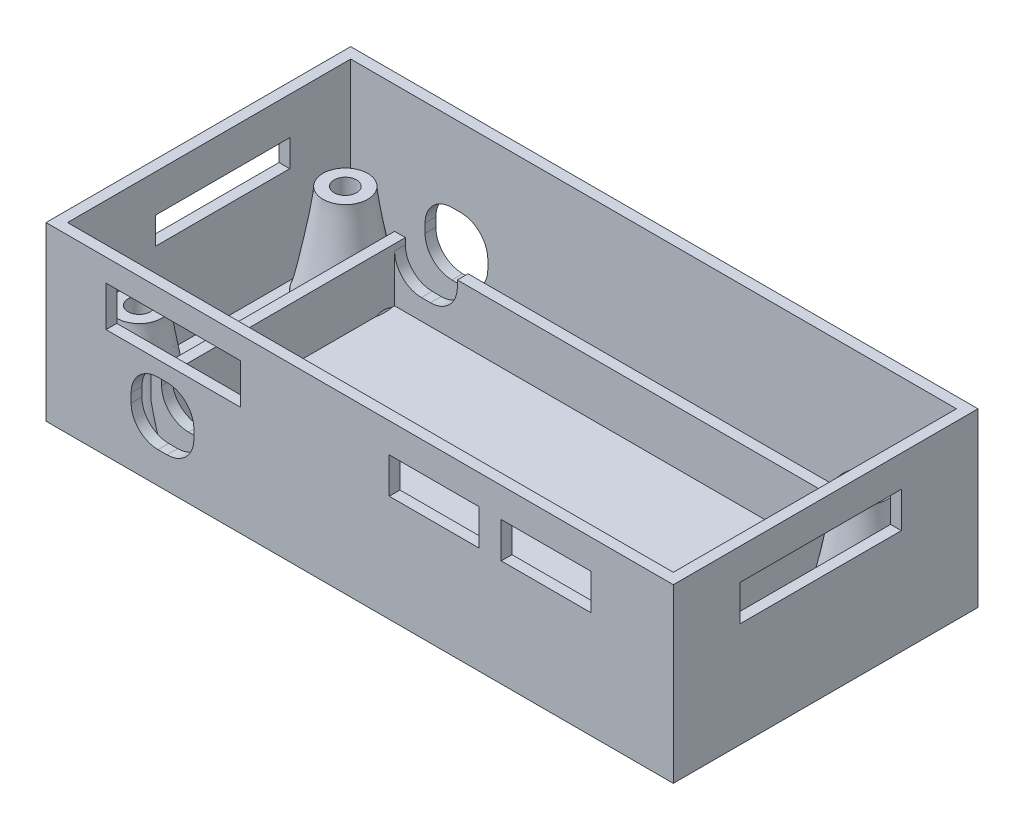
from build123d import *

# Parameters (mm, degrees)
SKETCH1_W           = 70
SKETCH1_H           = 34
BOSS_EXTRUDE1_DEPTH = 1.2
SKETCH2_W           = 70
SKETCH2_H           = 34
SKETCH2_W_2         = 67.6
SKETCH2_H_2         = 31.6
BOSS_EXTRUDE2_DEPTH = 18
SKETCH3_R           = 2.5
BOSS_EXTRUDE3_DEPTH = 10
SKETCH4_R           = 1.25
CUT_EXTRUDE1_DEPTH  = 79.622134288
SKETCH5_W           = 15
SKETCH5_H           = 3
CUT_EXTRUDE2_DEPTH  = 2
SKETCH7_W           = 10
SKETCH7_H           = 4
CUT_EXTRUDE3_DEPTH  = 2
SKETCH8_W           = 15
SKETCH8_H           = 4.5
CUT_EXTRUDE4_DEPTH  = 2
SKETCH9_W           = 18
SKETCH9_H           = 4
CUT_EXTRUDE5_DEPTH  = 2
FILLET1_SIZE        = 1.9
FILLET1_SIZE_2      = 10
SKETCH10_W          = 51.9
SKETCH10_H          = 27.2
SKETCH10_W_2        = 49.5
SKETCH10_H_2        = 24.8
BOSS_EXTRUDE4_DEPTH = 6
SKETCH12_W          = 7
SKETCH12_H          = 7
CUT_EXTRUDE7_DEPTH  = 81.153852084
FILLET2_R           = 3


with BuildPart() as part:
    # Sketch1 → Boss-Extrude1 (new body)
    with BuildSketch(Plane(origin=(0, 0, 0), x_dir=(1, 0, 0), z_dir=(0, 1, 0))):
        with Locations((35, -17)):
            Rectangle(SKETCH1_W, SKETCH1_H)
    extrude(amount=BOSS_EXTRUDE1_DEPTH)

    # Sketch2 → Boss-Extrude2 (add)
    with BuildSketch(Plane(origin=(0, 1.2, 0), x_dir=(1, 0, 0), z_dir=(0, 1, 0))):
        with Locations((35, -17)):
            Rectangle(SKETCH2_W, SKETCH2_H)
        with Locations((35, -17)):
            Rectangle(SKETCH2_W_2, SKETCH2_H_2, mode=Mode.SUBTRACT)
    extrude(amount=BOSS_EXTRUDE2_DEPTH)

    # Sketch3 → Boss-Extrude3 (add)
    with BuildSketch(Plane(origin=(0, 1.2, 0), x_dir=(1, 0, 0), z_dir=(0, 1, 0))):
        with Locations(Location((5.2, -28.8, 0), (0, 0, 270))):
            Circle(SKETCH3_R)
        with Locations(Location((63.2, -28.8, 0), (0, 0, 270))):
            Circle(SKETCH3_R)
        with Locations(Location((63.2, -5.8, 0), (0, 0, 270))):
            Circle(SKETCH3_R)
        with Locations(Location((5.2, -5.8, 0), (0, 0, 270))):
            Circle(SKETCH3_R)
    extrude(amount=BOSS_EXTRUDE3_DEPTH)

    # Sketch4 → Cut-Extrude1 (cut, through all)
    with BuildSketch(Plane(origin=(0, 11.2, 0), x_dir=(1, 0, 0), z_dir=(0, 1, 0))):
        with Locations(Location((5.2, -28.8, 0), (0, 0, 270))):
            Circle(SKETCH4_R)
        with Locations(Location((5.2, -5.8, 0), (0, 0, 270))):
            Circle(SKETCH4_R)
        with Locations(Location((63.2, -5.8, 0), (0, 0, 270))):
            Circle(SKETCH4_R)
        with Locations(Location((63.2, -28.8, 0), (0, 0, 270))):
            Circle(SKETCH4_R)
    extrude(amount=-CUT_EXTRUDE1_DEPTH, mode=Mode.SUBTRACT)

    # Sketch5 → Cut-Extrude2 (cut)
    with BuildSketch(Plane.ZY):
        with Locations((15.5, 13.5)):
            Rectangle(SKETCH5_W, SKETCH5_H)
    extrude(amount=-CUT_EXTRUDE2_DEPTH, mode=Mode.SUBTRACT)

    # Sketch7 → Cut-Extrude3 (cut)
    with BuildSketch(Plane(origin=(0, 0, 32.8), x_dir=(-1, 0, 0), z_dir=(0, 0, -1))):
        with Locations((-55.8, 13.9)):
            Rectangle(SKETCH7_W, SKETCH7_H)
        with Locations((-43.3, 13.9)):
            Rectangle(SKETCH7_W, SKETCH7_H)
    extrude(amount=-CUT_EXTRUDE3_DEPTH, mode=Mode.SUBTRACT)

    # Sketch8 → Cut-Extrude4 (cut)
    with BuildSketch(Plane(origin=(0, 0, 32.8), x_dir=(-1, 0, 0), z_dir=(0, 0, -1))):
        with Locations((-14.2, 14.45)):
            Rectangle(SKETCH8_W, SKETCH8_H)
    extrude(amount=-CUT_EXTRUDE4_DEPTH, mode=Mode.SUBTRACT)

    # Sketch9 → Cut-Extrude5 (cut)
    with BuildSketch(Plane.ZY.offset(-68.8)):
        with Locations((17.55, 13.7)):
            Rectangle(SKETCH9_W, SKETCH9_H)
    extrude(amount=-CUT_EXTRUDE5_DEPTH, mode=Mode.SUBTRACT)

    # Fillet1
    # a fillet whose section is not a circle: 10, 1.9 mm, written as the material it adds along each edge
    with BuildSketch(Plane(origin=(5.2, 1.2, 28.8), x_dir=(0, 0, 1), z_dir=(-1, 0, 0))) as fillet1_piece_1:
        with BuildLine():
            Bezier((2.5 + FILLET1_SIZE, 0), (2.5, 0), (2.5, FILLET1_SIZE_2), weights=[1, 0.111111111, 1])
            Line((2.5, FILLET1_SIZE_2), (2.5, 0))
            Line((2.5, 0), (2.5 + FILLET1_SIZE, 0))
        make_face()
    revolve(axis=Axis((5.2, 1.2, 28.8), (0, 1, 0)))
    with BuildSketch(Plane(origin=(63.2, 1.2, 28.8), x_dir=(0, 0, 1), z_dir=(-1, 0, 0))) as fillet1_piece_2:
        with BuildLine():
            Bezier((2.5 + FILLET1_SIZE, 0), (2.5, 0), (2.5, FILLET1_SIZE_2), weights=[1, 0.111111111, 1])
            Line((2.5, FILLET1_SIZE_2), (2.5, 0))
            Line((2.5, 0), (2.5 + FILLET1_SIZE, 0))
        make_face()
    revolve(axis=Axis((63.2, 1.2, 28.8), (0, 1, 0)))
    with BuildSketch(Plane(origin=(63.2, 1.2, 5.8), x_dir=(0, 0, 1), z_dir=(-1, 0, 0))) as fillet1_piece_3:
        with BuildLine():
            Bezier((2.5 + FILLET1_SIZE, 0), (2.5, 0), (2.5, FILLET1_SIZE_2), weights=[1, 0.111111111, 1])
            Line((2.5, FILLET1_SIZE_2), (2.5, 0))
            Line((2.5, 0), (2.5 + FILLET1_SIZE, 0))
        make_face()
    revolve(axis=Axis((63.2, 1.2, 5.8), (0, 1, 0)))
    with BuildSketch(Plane(origin=(5.2, 1.2, 5.8), x_dir=(0, 0, 1), z_dir=(-1, 0, 0))) as fillet1_piece_4:
        with BuildLine():
            Bezier((2.5 + FILLET1_SIZE, 0), (2.5, 0), (2.5, FILLET1_SIZE_2), weights=[1, 0.111111111, 1])
            Line((2.5, FILLET1_SIZE_2), (2.5, 0))
            Line((2.5, 0), (2.5 + FILLET1_SIZE, 0))
        make_face()
    revolve(axis=Axis((5.2, 1.2, 5.8), (0, 1, 0)))

    # Sketch10 → Boss-Extrude4 (add)
    with BuildSketch(Plane(origin=(0, 1.2, 0), x_dir=(1, 0, 0), z_dir=(0, 1, 0))):
        with Locations((34.25, -17)):
            Rectangle(SKETCH10_W, SKETCH10_H)
        with Locations((34.25, -17)):
            Rectangle(SKETCH10_W_2, SKETCH10_H_2, mode=Mode.SUBTRACT)
    extrude(amount=BOSS_EXTRUDE4_DEPTH)

    # Sketch12 → Cut-Extrude7 (cut, through all)
    with BuildSketch(Plane(origin=(0, 0, 0), x_dir=(-1, 0, 0), z_dir=(0, 0, -1))):
        with Locations((-13, 7)):
            Rectangle(SKETCH12_W, SKETCH12_H)
    extrude(amount=-CUT_EXTRUDE7_DEPTH, mode=Mode.SUBTRACT)

    # Fillet2
    fillet2_edges = [part.edges().sort_by_distance(p)[0] for p in [
        (16.5, 10.5, 33.4),
        (9.5, 10.5, 33.4),
        (16.5, 3.5, 33.4),
        (16.5, 3.5, 30),
        (16.5, 3.5, 0.6),
        (9.5, 3.5, 30),
        (9.5, 3.5, 33.4),
        (9.5, 3.5, 4),
        (9.5, 10.5, 0.6),
        (9.5, 3.5, 0.6),
        (16.5, 3.5, 4),
        (16.5, 10.5, 0.6),
    ]]
    fillet(fillet2_edges, radius=FILLET2_R)


solid = part.part
